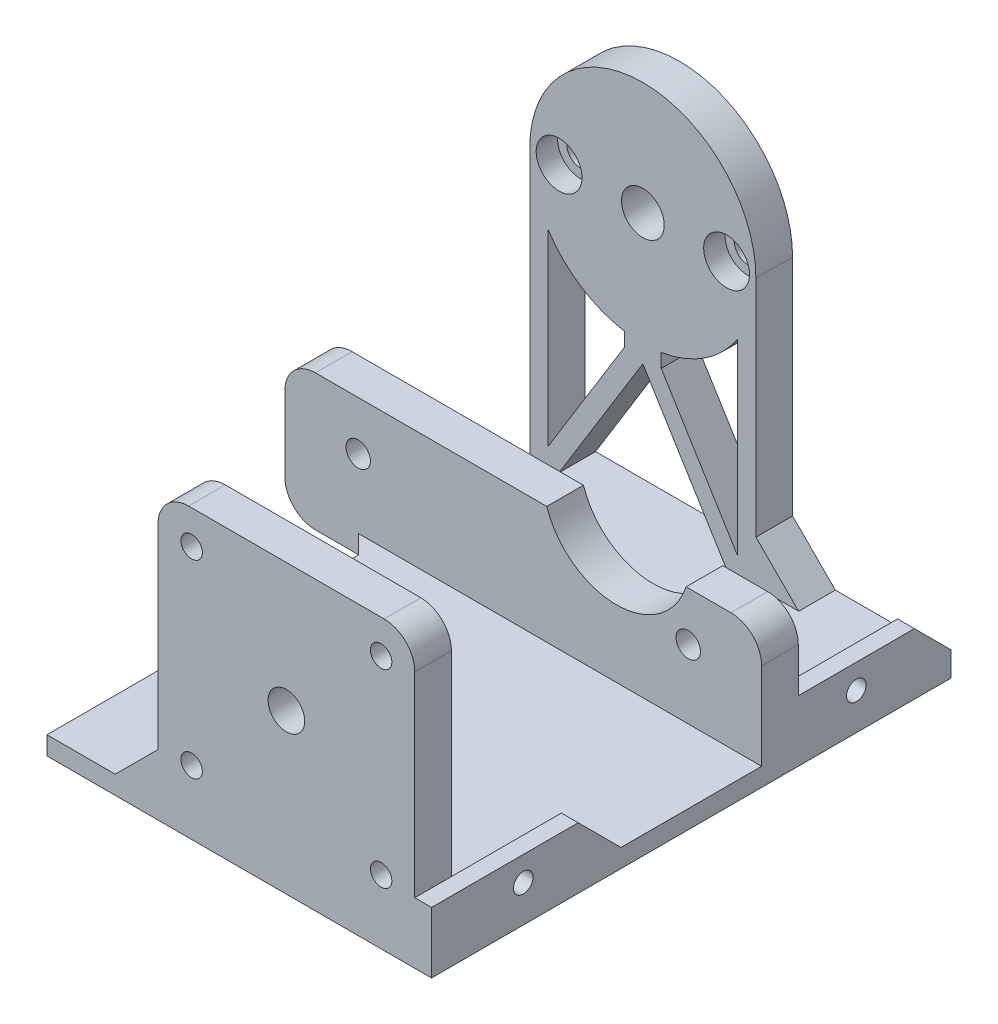
from build123d import *

# Parameters (mm, degrees)
SKETCH1_R           = 18.5
SKETCH1_R_2         = 3.5
SKETCH1_R_3         = 2.25
BOSS_EXTRUDE1_DEPTH = 6
SKETCH2_R           = 3.75
CUT_EXTRUDE1_DEPTH  = 3.5
BOSS_EXTRUDE2_START = -6
BOSS_EXTRUDE2_DEPTH = 6
SKETCH4_W           = 62.93
SKETCH4_H           = 3
BOSS_EXTRUDE3_DEPTH = 85
SKETCH6_R           = 2
BOSS_EXTRUDE5_DEPTH = 6
SKETCH5_W           = 42
SKETCH5_H           = 44
SKETCH5_R           = 1.75
SKETCH5_R_2         = 3
BOSS_EXTRUDE4_DEPTH = 6
SKETCH7_W           = 15.07
SKETCH7_H           = 6
BOSS_EXTRUDE6_DEPTH = 3
CHAMFER1_SIZE       = 3
SKETCH8_W           = 6
SKETCH8_H           = 7
SKETCH8_W_2         = 18
SKETCH8_R           = 1.6
SKETCH8_W_3         = 19
BOSS_EXTRUDE7_DEPTH = 2.75
CHAMFER2_SIZE       = 7
FILLET1_R           = 5
CHAMFER3_SIZE       = 3


with BuildPart() as part:
    # Sketch1 → Boss-Extrude1 (new body)
    with BuildSketch(Plane.XY):
        Circle(SKETCH1_R)
        Circle(SKETCH1_R_2, mode=Mode.SUBTRACT)
        with Locations((-13.7, 0)):
            Circle(SKETCH1_R_3, mode=Mode.SUBTRACT)
        with Locations((13.7, 0)):
            Circle(SKETCH1_R_3, mode=Mode.SUBTRACT)
    extrude(amount=BOSS_EXTRUDE1_DEPTH)

    # Sketch2 → Cut-Extrude1 (cut)
    with BuildSketch(Plane.XY.offset(6)):
        with Locations((-13.7, 0)):
            Circle(SKETCH2_R)
        with Locations((13.7, 0)):
            Circle(SKETCH2_R)
    extrude(amount=-CUT_EXTRUDE1_DEPTH, mode=Mode.SUBTRACT)

    # Sketch3 → Boss-Extrude2 (add)
    with BuildSketch(Plane.XY.offset(6).offset(BOSS_EXTRUDE2_START)):
        with BuildLine():
            ThreePointArc((-15.5, -10.099504938), (-17.734147851, -5.267826876), (-18.5, 0))
            Line((-18.5, 0), (-18.5, -46.68))
            Line((-18.5, -46.68), (18.5, -46.68))
            Line((18.5, -46.68), (18.5, 0))
            ThreePointArc((18.5, 0), (17.734147851, -5.267826876), (15.5, -10.099504938))
            Line((15.5, -10.099504938), (15.5, -40.818554828))
            Line((15.5, -40.818554828), (15.5, -43.68))
            Line((15.5, -43.68), (13.738586173, -43.68))
            Line((13.738586173, -43.68), (-13.738586173, -43.68))
            Line((-13.738586173, -43.68), (-15.5, -43.68))
            Line((-15.5, -43.68), (-15.5, -40.818554828))
            Line((-15.5, -40.818554828), (-15.5, -10.099504938))
        make_face()
        with BuildLine():
            Line((-3, -20.512103215), (-15.5, -40.818554828))
            Line((-15.5, -40.818554828), (-15.5, -43.68))
            Line((-15.5, -43.68), (-13.738586173, -43.68))
            Line((-13.738586173, -43.68), (0, -21.361445172))
            Line((0, -21.361445172), (13.738586173, -43.68))
            Line((13.738586173, -43.68), (15.5, -43.68))
            Line((15.5, -43.68), (15.5, -40.818554828))
            Line((15.5, -40.818554828), (3, -20.512103215))
            Line((3, -20.512103215), (1.71251735, -18.420566884))
            ThreePointArc((1.71251735, -18.420566884), (0, -18.5), (-1.71251735, -18.420566884))
            Line((-1.71251735, -18.420566884), (-3, -20.512103215))
        make_face()
        with BuildLine():
            Line((3, -20.512103215), (3, -18.255136264))
            ThreePointArc((3, -18.255136264), (2.357710068, -18.349147207), (1.71251735, -18.420566884))
            Line((1.71251735, -18.420566884), (3, -20.512103215))
        make_face()
        with BuildLine():
            ThreePointArc((-1.71251735, -18.420566884), (-2.357710068, -18.349147207), (-3, -18.255136264))
            Line((-3, -18.255136264), (-3, -20.512103215))
            Line((-3, -20.512103215), (-1.71251735, -18.420566884))
        make_face()
    extrude(amount=BOSS_EXTRUDE2_DEPTH)

    # Sketch4 → Boss-Extrude3 (add)
    with BuildSketch(Plane.XY):
        with Locations((12.965, -45.18)):
            Rectangle(SKETCH4_W, SKETCH4_H)
    extrude(amount=BOSS_EXTRUDE3_DEPTH)

    # Sketch6 → Boss-Extrude5 (add)
    with BuildSketch(Plane(origin=(0, 0, 31), x_dir=(-1, 0, 0), z_dir=(0, 0, -1))):
        with BuildLine():
            Line((-44.43, -24.43), (-44.43, -43.68))
            Line((-44.43, -43.68), (33.57, -43.68))
            Line((33.57, -43.68), (33.57, -24.43))
            Line((33.57, -24.43), (-9.280986885, -24.43))
            ThreePointArc((-9.280986885, -24.43), (-20.68, -32.68), (-32.079013115, -24.43))
            Line((-32.079013115, -24.43), (-44.43, -24.43))
        make_face()
        with Locations((-32.43, -32.43)):
            Circle(SKETCH6_R, mode=Mode.SUBTRACT)
        with Locations((21.57, -32.43)):
            Circle(SKETCH6_R, mode=Mode.SUBTRACT)
    extrude(amount=BOSS_EXTRUDE5_DEPTH)

    # Sketch5 → Boss-Extrude4 (add)
    with BuildSketch(Plane.XY.offset(85)):
        with Locations((20.68, -21.68)):
            Rectangle(SKETCH5_W, SKETCH5_H)
        with Locations((5.18, -36.18)):
            Circle(SKETCH5_R, mode=Mode.SUBTRACT)
        with Locations((36.18, -36.18)):
            Circle(SKETCH5_R, mode=Mode.SUBTRACT)
        with Locations((5.18, -5.18)):
            Circle(SKETCH5_R, mode=Mode.SUBTRACT)
        with Locations((20.68, -20.68)):
            Circle(SKETCH5_R_2, mode=Mode.SUBTRACT)
        with Locations((36.18, -5.18)):
            Circle(SKETCH5_R, mode=Mode.SUBTRACT)
    extrude(amount=-BOSS_EXTRUDE4_DEPTH)

    # Sketch7 → Boss-Extrude6 (add)
    with BuildSketch(Plane.XZ.offset(46.68)):
        with Locations((-26.035, 28)):
            Rectangle(SKETCH7_W, SKETCH7_H)
    extrude(amount=-BOSS_EXTRUDE6_DEPTH)

    # Chamfer1
    chamfer1_edges = [part.edges().sort_by_distance(p)[0] for p in [
        (-18.5, -45.18, 31),
        (-18.5, -45.18, 25),
    ]]
    chamfer(chamfer1_edges, length=CHAMFER1_SIZE)

    # Sketch8 → Boss-Extrude7 (add)
    # profile 1 of 3: a face of its own
    with BuildSketch(Plane(origin=(44.43, 0, 0), x_dir=(0, 0, -1), z_dir=(1, 0, 0))):
        with Locations((-82, -40.18)):
            Rectangle(SKETCH8_W, SKETCH8_H)
    # profile 2 of 3: a face of its own
    with BuildSketch(Plane(origin=(44.43, 0, 0), x_dir=(0, 0, -1), z_dir=(1, 0, 0))):
        with Locations((-70, -40.18)):
            Rectangle(SKETCH8_W_2, SKETCH8_H)
        with Locations((-70, -40.68)):
            Circle(SKETCH8_R, mode=Mode.SUBTRACT)
    # profile 3 of 3: a face of its own
    with BuildSketch(Plane(origin=(44.43, 0, 0), x_dir=(0, 0, -1), z_dir=(1, 0, 0))):
        with Locations((-15.5, -40.18)):
            Rectangle(SKETCH8_W_3, SKETCH8_H)
        with Locations((-15.5, -40.68)):
            Circle(SKETCH8_R, mode=Mode.SUBTRACT)
    extrude(amount=-BOSS_EXTRUDE7_DEPTH)

    # Chamfer2
    # the kernel refuses this chamfer: 7 mm, written as the material it adds along each edge
    with BuildSketch(Plane(origin=(-0.32, -43.68, 85), x_dir=(-0.9996219169112968, -0.02749587661058612, 0), z_dir=(0, 0, -1)), Plane(origin=(18.5, -43.68, 0), x_dir=(0.9996219169112968, -0.027495876610586112, 0), z_dir=(0, 0, 1))) as chamfer2_piece_1:
        Polygon((CHAMFER2_SIZE * 0.999621916911, CHAMFER2_SIZE * 0.0274958766106), (-CHAMFER2_SIZE * 0.0274958766106, CHAMFER2_SIZE * 0.999621916911), (0, 0), align=None)
    extrude(amount=6)
    with BuildSketch(Plane(origin=(44.43, -43.68, 6), x_dir=(0, -0.02749587661058612, -0.9996219169112968), z_dir=(-1, 0, 0))) as chamfer2_piece_2_section:
        Polygon((CHAMFER2_SIZE * 0.999621916911, -CHAMFER2_SIZE * 0.0274958766106), (-CHAMFER2_SIZE * 0.0274958766106, -CHAMFER2_SIZE * 0.999621916911), (0, 0), align=None)
    chamfer2_piece_2 = extrude(amount=2.75, mode=Mode.PRIVATE)
    chamfer2_piece_2 = split(chamfer2_piece_2, bisect_by=Plane(origin=(43.055, -41.310788547, 0), z_dir=(0, 0, 1)), keep=Keep.TOP, mode=Mode.PRIVATE)
    chamfer2_piece_2 = split(chamfer2_piece_2, bisect_by=Plane(origin=(43.055, -36.68, 3.818532593), z_dir=(0, -1, 0)), keep=Keep.TOP, mode=Mode.PRIVATE)
    add(chamfer2_piece_2)
    with BuildSketch(Plane(origin=(44.43, -43.68, 61), x_dir=(0, -0.027495876610586126, -0.9996219169112968), z_dir=(-1, 0, 0))) as chamfer2_piece_3_section:
        Polygon((CHAMFER2_SIZE * 0.999621916911, -CHAMFER2_SIZE * 0.0274958766106), (-CHAMFER2_SIZE * 0.0274958766106, -CHAMFER2_SIZE * 0.999621916911), (0, 0), align=None)
    chamfer2_piece_3 = extrude(amount=2.75, mode=Mode.PRIVATE)
    chamfer2_piece_3 = split(chamfer2_piece_3, bisect_by=Plane(origin=(43.055, -36.68, 58.68717092), z_dir=(0, -1, 0)), keep=Keep.TOP, mode=Mode.PRIVATE)
    add(chamfer2_piece_3)

    # Fillet1
    fillet1_edges = [part.edges().sort_by_distance(p)[0] for p in [
        (44.43, -24.43, 28),
        (-33.57, -24.43, 28),
        (-0.32, 0.32, 82),
        (41.68, 0.32, 82),
        (-33.57, -46.68, 28),
    ]]
    fillet(fillet1_edges, radius=FILLET1_R)

    # Chamfer3
    # the kernel refuses this chamfer: 3 mm, written as the material it takes off along each edge
    with BuildSketch(Plane(origin=(-21.57, -32.43, 25), x_dir=(-1, 0, 0), z_dir=(0, -1, 0))) as chamfer3_piece_1:
        Polygon((2, -CHAMFER3_SIZE), (2 + CHAMFER3_SIZE, 0), (2, 0), align=None)
    revolve(axis=Axis((-21.57, -32.43, 25), (0, 0, -1)), mode=Mode.SUBTRACT)
    with BuildSketch(Plane(origin=(32.43, -32.43, 25), x_dir=(-1, 0, 0), z_dir=(0, -1, 0))) as chamfer3_piece_2:
        Polygon((2, -CHAMFER3_SIZE), (2 + CHAMFER3_SIZE, 0), (2, 0), align=None)
    revolve(axis=Axis((32.43, -32.43, 25), (0, 0, -1)), mode=Mode.SUBTRACT)


solid = part.part
